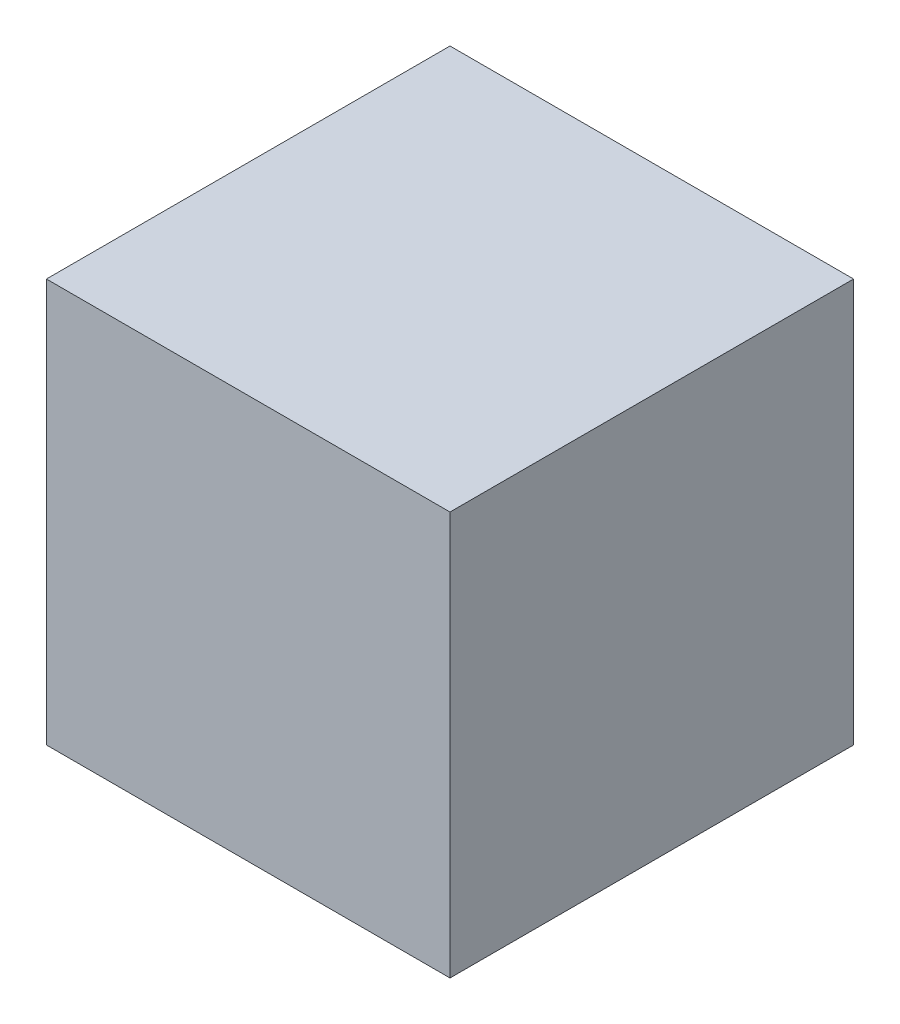
from build123d import *

# Parameters (mm, degrees)
SKETCH_1_W      = 250
SKETCH_1_H      = 250
EXTRUDE_1_DEPTH = 250


with BuildPart() as part:
    # Эскиз1 → Бобышка-Вытянуть1 (new body)
    with BuildSketch(Plane(origin=(0, 0, 0), x_dir=(1, 0, 0), z_dir=(0, 1, 0))):
        with Locations((125, 125)):
            Rectangle(SKETCH_1_W, SKETCH_1_H)
    extrude(amount=EXTRUDE_1_DEPTH)


solid = part.part
